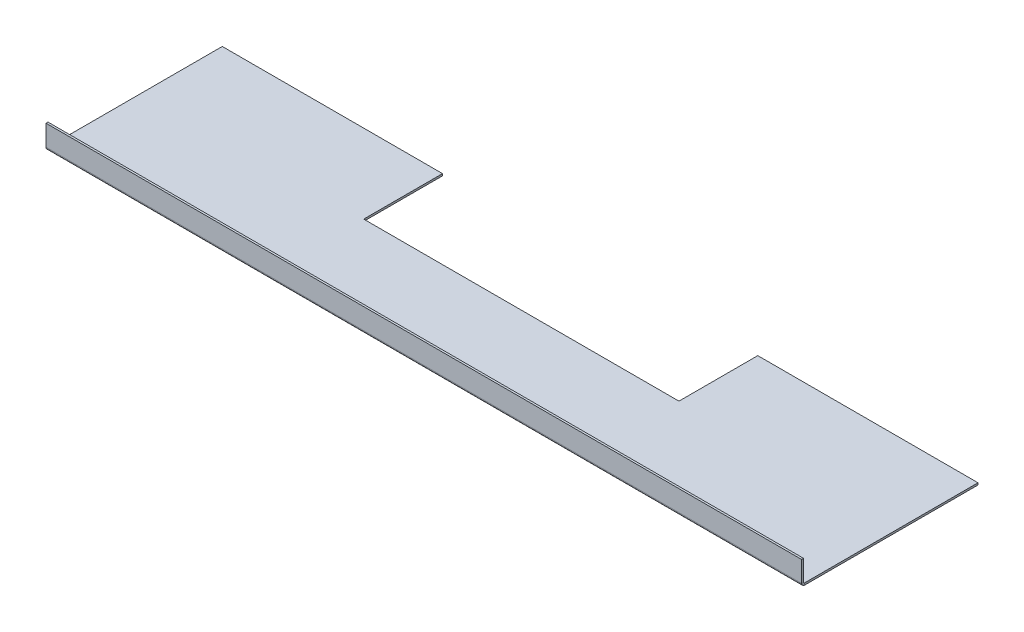
from build123d import *

# Parameters (mm, degrees)
BASE_FLANGE1_DEPTH = 1.5875
EDGE_FLANGE1_DEPTH = 608.838


# Sheet-metal steps are written as plain solids
with BuildPart() as part:
    # Sketch1 → Base-Flange1 (new body)
    with BuildSketch(Plane(origin=(0, 0, 0), x_dir=(1, 0, 0), z_dir=(0, 1, 0))):
        Polygon((-304.419, 69.85), (-127, 69.85), (-127, 6.35), (127, 6.35), (127, 69.85), (304.419, 69.85), (304.419, -69.85), (-304.419, -69.85), align=None)
    extrude(amount=-BASE_FLANGE1_DEPTH)

    # Edge-Flange1 section (across the edge) → Edge-Flange1 (add)
    with BuildSketch(Plane(origin=(-304.419, 0, 70.5866), x_dir=(0, 0, -1), z_dir=(1, 0, 0))):
        with BuildLine():
            Line((-1.5875, 0.7366), (-1.5875, 17.4625))
            Line((-1.5875, 17.4625), (0, 17.4625))
            Line((0, 17.4625), (0, 0.7366))
            ThreePointArc((0, 0.7366), (0.215745145, 0.215745145), (0.7366, 0))
            Line((0.7366, 0), (0.7366, -1.5875))
            ThreePointArc((0.7366, -1.5875), (-0.90678687, -0.90678687), (-1.5875, 0.7366))
        make_face()
    extrude(amount=EDGE_FLANGE1_DEPTH)


solid = part.part
